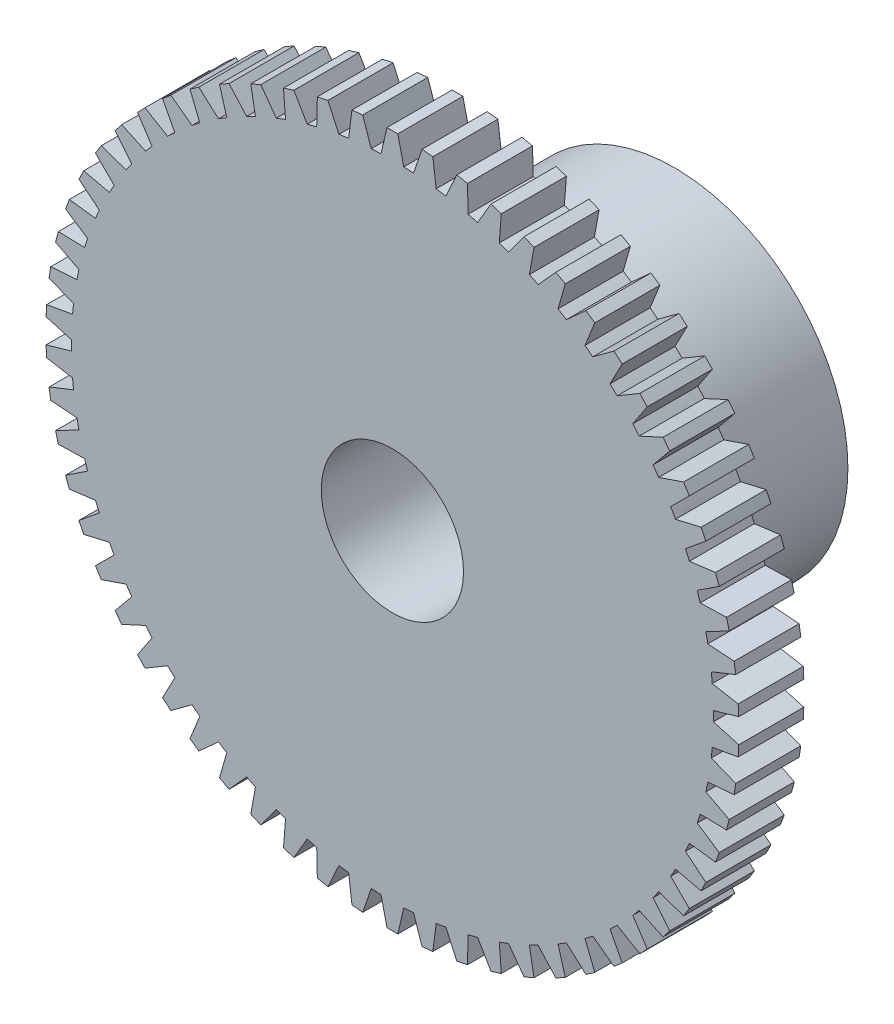
from build123d import *

# Parameters (mm, degrees)
SKETCH1_R           = 14.8
BOSS_EXTRUDE1_DEPTH = 3
BOSS_EXTRUDE2_DEPTH = 3
CIRPATTERN1_COUNT   = 62
SKETCH3_R           = 8
BOSS_EXTRUDE3_DEPTH = 13
SKETCH5_R           = 3.278
CUT_EXTRUDE2_DEPTH  = 13


with BuildPart() as part:
    # Sketch1 → Boss-Extrude1 (new body)
    with BuildSketch(Plane.XY):
        Circle(SKETCH1_R)
    extrude(amount=BOSS_EXTRUDE1_DEPTH)

    # Sketch2 → Boss-Extrude2 (add)
    with BuildSketch(Plane.XY.offset(3)):
        Polygon((0.25, 15.973740798), (-0.25, 15.973740798), (-0.55, 14.675816187), (0.549888121, 14.675816187), align=None)
    boss_extrude2 = extrude(amount=-BOSS_EXTRUDE2_DEPTH)

    # CirPattern1: Boss-Extrude2 ×62 about axis
    cirpattern1_axis = Axis((0, 0, 3), (0, 0, -1))
    for i in range(1, CIRPATTERN1_COUNT):
        add(boss_extrude2.rotate(cirpattern1_axis, i * 360 / CIRPATTERN1_COUNT))

    # Sketch3 → Boss-Extrude3 (add)
    with BuildSketch(Plane.XY.offset(3)):
        Circle(SKETCH3_R)
    extrude(amount=-BOSS_EXTRUDE3_DEPTH)

    # Sketch5 → Cut-Extrude2 (cut)
    with BuildSketch(Plane.XY.offset(3)):
        Circle(SKETCH5_R)
    extrude(amount=-CUT_EXTRUDE2_DEPTH, mode=Mode.SUBTRACT)


solid = part.part
